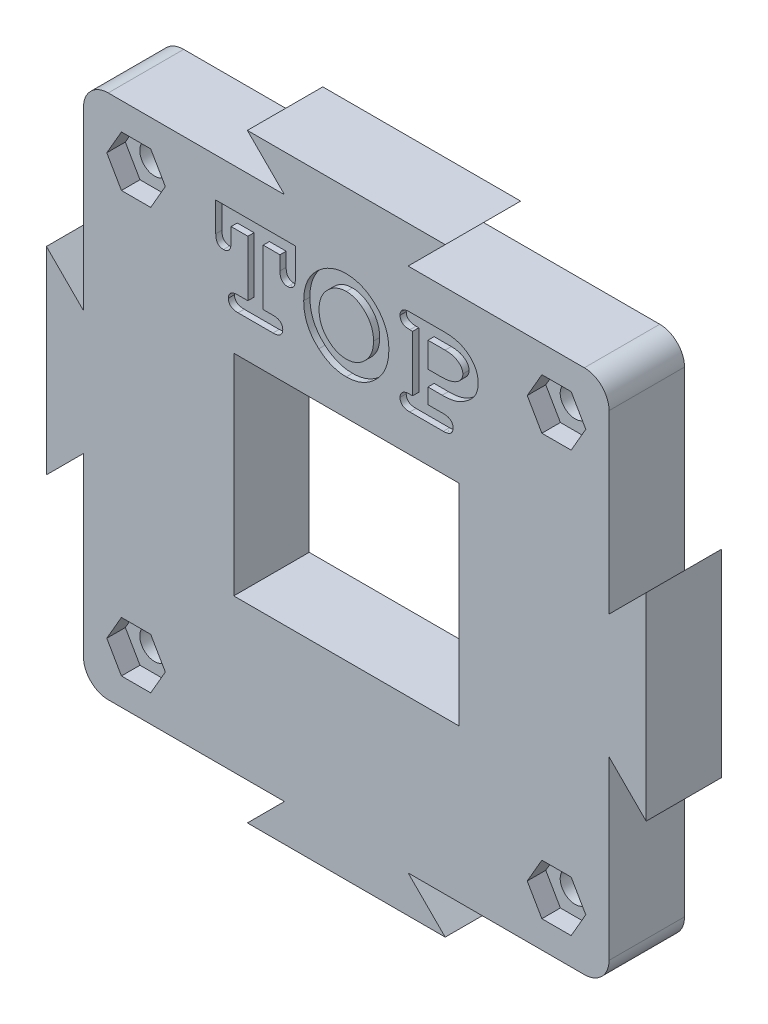
from build123d import *

# Parameters (mm, degrees)
SKETCH1_R           = 1.2
SKETCH1_W           = 18.2
SKETCH1_H           = 17
BOSS_EXTRUDE1_DEPTH = 6.1
CUT_EXTRUDE3_DEPTH  = 1
CUT_EXTRUDE4_DEPTH  = 1.5
CUT_EXTRUDE5_DEPTH  = 0.5


with BuildPart() as part:
    # Sketch1 → Boss-Extrude1 (new body)
    with BuildSketch(Plane.XY):
        with BuildLine():
            Line((-5, 21.25), (-19.25, 21.25))
            ThreePointArc((-19.25, 21.25), (-20.664213562, 20.664213562), (-21.25, 19.25))
            Line((-21.25, 19.25), (-21.25, 5))
            Line((-21.25, 5), (-24.25, 8))
            Line((-24.25, 8), (-24.25, -8))
            Line((-24.25, -8), (-21.25, -5))
            Line((-21.25, -5), (-21.25, -19.25))
            ThreePointArc((-21.25, -19.25), (-20.664213562, -20.664213562), (-19.25, -21.25))
            Line((-19.25, -21.25), (-5, -21.25))
            Line((-5, -21.25), (-8, -24.25))
            Line((-8, -24.25), (8, -24.25))
            Line((8, -24.25), (5, -21.25))
            Line((5, -21.25), (19.25, -21.25))
            ThreePointArc((19.25, -21.25), (20.664213562, -20.664213562), (21.25, -19.25))
            Line((21.25, -19.25), (21.25, -5))
            Line((21.25, -5), (24.25, -8))
            Line((24.25, -8), (24.25, 8))
            Line((24.25, 8), (21.25, 5))
            Line((21.25, 5), (21.25, 19.25))
            ThreePointArc((21.25, 19.25), (20.664213562, 20.664213562), (19.25, 21.25))
            Line((19.25, 21.25), (5, 21.25))
            Line((5, 21.25), (8, 24.25))
            Line((8, 24.25), (-8, 24.25))
            Line((-8, 24.25), (-5, 21.25))
        make_face()
        with Locations((-17, -17)):
            Circle(SKETCH1_R, mode=Mode.SUBTRACT)
        with Locations((17, -17)):
            Circle(SKETCH1_R, mode=Mode.SUBTRACT)
        with Locations((17, 17)):
            Circle(SKETCH1_R, mode=Mode.SUBTRACT)
        with Locations((-17, 17)):
            Circle(SKETCH1_R, mode=Mode.SUBTRACT)
        with Locations((0, -0.4)):
            Rectangle(SKETCH1_W, SKETCH1_H, mode=Mode.SUBTRACT)
    extrude(amount=BOSS_EXTRUDE1_DEPTH)

    # Sketch2 → Cut-Extrude3 (cut)
    with BuildSketch(Plane(origin=(0, 0, 0), x_dir=(-1, 0, 0), z_dir=(0, 0, -1))):
        with BuildLine():
            Line((-9.5, 18.25), (9.5, 18.25))
            ThreePointArc((9.5, 18.25), (10.75, 17), (9.5, 15.75))
            Line((9.5, 15.75), (-9.5, 15.75))
            ThreePointArc((-9.5, 15.75), (-10.75, 17), (-9.5, 18.25))
        make_face()
    extrude(amount=-CUT_EXTRUDE3_DEPTH, mode=Mode.SUBTRACT)

    # Sketch3 → Cut-Extrude4 (cut)
    with BuildSketch(Plane.XY.offset(6.1)):
        Polygon((-18.183568052, -14.95), (-19.367136104, -17), (-18.183568052, -19.05), (-15.816431948, -19.05), (-14.632863896, -17), (-15.816431948, -14.95), align=None)
        Polygon((15.816431948, -14.95), (14.632863896, -17), (15.816431948, -19.05), (18.183568052, -19.05), (19.367136104, -17), (18.183568052, -14.95), align=None)
        Polygon((-18.183568052, 19.05), (-19.367136104, 17), (-18.183568052, 14.95), (-15.816431948, 14.95), (-14.632863896, 17), (-15.816431948, 19.05), align=None)
        Polygon((15.816431948, 19.05), (14.632863896, 17), (15.816431948, 14.95), (18.183568052, 14.95), (19.367136104, 17), (18.183568052, 19.05), align=None)
    extrude(amount=-CUT_EXTRUDE4_DEPTH, mode=Mode.SUBTRACT)

    # Sketch4 → Cut-Extrude5 (cut)
    # profile 1 of 3: a face of its own
    with BuildSketch(Plane.XY.offset(6.1)):
        with BuildLine():
            Line((-6.717741935, 16.858064516), (-6.717741935, 12.341935484))
            Line((-6.717741935, 12.341935484), (-5.927419355, 12.341935484))
            add(Edge.make_bspline(
                [(-5.927419355, 12.341935484), (-5.863148246, 12.340349698), (-5.742415246, 12.337370807), (-5.575414873, 12.304299508), (-5.435165873, 12.250599117), (-5.324117222, 12.172513537), (-5.240499467, 12.077832245), (-5.180080261, 11.970275939), (-5.143989419, 11.8496603), (-5.139440666, 11.764730535), (-5.137096774, 11.720967742)],
                knots=[0, 0, 0, 0, 1.353154287, 2.541894464, 3.570795155, 4.495901044, 5.373971119, 6.211928534, 7.078638652, 8, 8, 8, 8], degree=3))
            add(Edge.make_bspline(
                [(-5.137096774, 11.720967742), (-5.139411719, 11.67718849), (-5.143904296, 11.592226784), (-5.18054359, 11.471340401), (-5.239890455, 11.36255897), (-5.32423841, 11.267819013), (-5.434764703, 11.189183916), (-5.575891283, 11.138241303), (-5.742334201, 11.104365055), (-5.86312009, 11.101516436), (-5.927419355, 11.1)],
                knots=[0, 0, 0, 0, 0.920639213, 1.786670031, 2.634802021, 3.512183892, 4.436564712, 5.460097794, 6.647906274, 8, 8, 8, 8], degree=3))
            Line((-5.927419355, 11.1), (-8.75, 11.1))
            add(Edge.make_bspline(
                [(-8.75, 11.1), (-8.814285929, 11.101533344), (-8.935046767, 11.104413724), (-9.101652606, 11.138083415), (-9.242728791, 11.189834025), (-9.354888209, 11.266612833), (-9.437344663, 11.363255186), (-9.496975861, 11.471245143), (-9.533487954, 11.592252578), (-9.537998419, 11.677197261), (-9.540322581, 11.720967742)],
                knots=[0, 0, 0, 0, 1.351758791, 2.539273031, 3.562552567, 4.496852515, 5.365850662, 6.213772556, 7.079588844, 8, 8, 8, 8], degree=3))
            add(Edge.make_bspline(
                [(-9.540322581, 11.720967742), (-9.537969451, 11.764721754), (-9.533402769, 11.849634476), (-9.497438896, 11.970370805), (-9.436744196, 12.07714303), (-9.355010217, 12.173719777), (-9.242323038, 12.249940289), (-9.102128968, 12.304456905), (-8.934965801, 12.337322371), (-8.814257801, 12.340332871), (-8.75, 12.341935484)],
                knots=[0, 0, 0, 0, 0.921132933, 1.787628184, 2.62537786, 3.495057466, 4.430090083, 5.458735699, 6.647181174, 8, 8, 8, 8], degree=3))
            Line((-8.75, 12.341935484), (-7.959677419, 12.341935484))
            Line((-7.959677419, 12.341935484), (-7.959677419, 16.858064516))
            Line((-7.959677419, 16.858064516), (-9.314516129, 16.858064516))
            Line((-9.314516129, 16.858064516), (-9.314516129, 15.729032258))
            add(Edge.make_bspline(
                [(-9.314516129, 15.729032258), (-9.316118741, 15.664774457), (-9.319129242, 15.544066457), (-9.351994707, 15.37690329), (-9.406511324, 15.23670922), (-9.482731835, 15.124022041), (-9.579308583, 15.042288062), (-9.686080808, 14.981593362), (-9.806817137, 14.945629489), (-9.891729859, 14.941062807), (-9.935483871, 14.938709677)],
                knots=[0, 0, 0, 0, 1.352818826, 2.541264301, 3.569909917, 4.504942534, 5.37462214, 6.212371816, 7.078867067, 8, 8, 8, 8], degree=3))
            add(Edge.make_bspline(
                [(-9.935483871, 14.938709677), (-9.979254352, 14.941033839), (-10.064199035, 14.945544304), (-10.18520647, 14.982056397), (-10.293196427, 15.041687595), (-10.38983878, 15.124144049), (-10.466617587, 15.236303467), (-10.518368198, 15.377379652), (-10.552037889, 15.543985491), (-10.554918269, 15.664746329), (-10.556451613, 15.729032258)],
                knots=[0, 0, 0, 0, 0.920411156, 1.786227444, 2.634149338, 3.503147485, 4.437447433, 5.460726969, 6.648241209, 8, 8, 8, 8], degree=3))
            Line((-10.556451613, 15.729032258), (-10.556451613, 18.1))
            Line((-10.556451613, 18.1), (-4.120967742, 18.1))
            Line((-4.120967742, 18.1), (-4.120967742, 15.729032258))
            add(Edge.make_bspline(
                [(-4.120967742, 15.729032258), (-4.122570354, 15.664774457), (-4.125580855, 15.544066457), (-4.15844632, 15.37690329), (-4.212962937, 15.23670922), (-4.289183448, 15.124022041), (-4.385760196, 15.042288062), (-4.492532421, 14.981593362), (-4.61326875, 14.945629489), (-4.698181472, 14.941062807), (-4.741935484, 14.938709677)],
                knots=[0, 0, 0, 0, 1.352818826, 2.541264301, 3.569909917, 4.504942534, 5.37462214, 6.212371816, 7.078867067, 8, 8, 8, 8], degree=3))
            add(Edge.make_bspline(
                [(-4.741935484, 14.938709677), (-4.785705965, 14.941033839), (-4.870650647, 14.945544304), (-4.991658082, 14.982056397), (-5.09964804, 15.041687595), (-5.196290393, 15.124144049), (-5.2730692, 15.236303467), (-5.324819811, 15.377379652), (-5.358489502, 15.543985491), (-5.361369882, 15.664746329), (-5.362903226, 15.729032258)],
                knots=[0, 0, 0, 0, 0.920411156, 1.786227444, 2.634149338, 3.503147485, 4.437447433, 5.460726969, 6.648241209, 8, 8, 8, 8], degree=3))
            Line((-5.362903226, 15.729032258), (-5.362903226, 16.858064516))
            Line((-5.362903226, 16.858064516), (-6.717741935, 16.858064516))
        make_face()
    # profile 2 of 3: a face of its own
    with BuildSketch(Plane.XY.offset(6.1)):
        with BuildLine():
            add(Edge.make_bspline(
                [(3.443548387, 14.596471774), (3.440768135, 14.469872192), (3.43530187, 14.220964285), (3.384240039, 13.856547556), (3.303430808, 13.508493952), (3.18990528, 13.176073594), (3.043492439, 12.85927086), (2.86230178, 12.559885998), (2.648367688, 12.277756214), (2.407032439, 12.014221053), (2.145091658, 11.774181148), (1.867939271, 11.56507818), (1.582463144, 11.385621278), (1.285073961, 11.239704237), (0.977784758, 11.125989141), (0.659276661, 11.047638273), (0.331615265, 10.995330959), (0.108991475, 10.989861286), (-0.003528226, 10.987096774)],
                knots=[0, 0, 0, 0, 1.094929274, 2.152744503, 3.177137145, 4.182820699, 5.186765039, 6.191160575, 7.204742221, 8.245594793, 9.279258829, 10.274526544, 11.245900401, 12.192545204, 13.135888647, 14.0750236, 15.027068184, 16, 16, 16, 16], degree=3))
            add(Edge.make_bspline(
                [(-0.003528226, 10.987096774), (-0.104783693, 10.990084079), (-0.305676528, 10.996010949), (-0.603005186, 11.03505148), (-0.892607204, 11.102249519), (-1.173562194, 11.198894748), (-1.448464178, 11.318909387), (-1.715948566, 11.466394913), (-1.976145498, 11.640710578), (-2.138659708, 11.775929717), (-2.221018145, 11.844455645)],
                knots=[0, 0, 0, 0, 0.999768647, 1.983560634, 2.955371214, 3.93036818, 4.913148714, 5.913625258, 6.942673607, 8, 8, 8, 8], degree=3))
            add(Edge.make_bspline(
                [(-2.221018145, 11.844455645), (-2.318278926, 11.934209759), (-2.510060195, 12.111189194), (-2.76018462, 12.40823581), (-2.970468425, 12.725657212), (-3.14586036, 13.061370626), (-3.279622713, 13.417629903), (-3.375322538, 13.7931879), (-3.432447151, 14.188380579), (-3.439800111, 14.458681857), (-3.443548387, 14.596471774)],
                knots=[0, 0, 0, 0, 1.020221724, 2.011699023, 2.986768456, 3.952539234, 4.927344826, 5.915360336, 6.937325315, 8, 8, 8, 8], degree=3))
            add(Edge.make_bspline(
                [(-3.443548387, 14.596471774), (-3.439810363, 14.734263637), (-3.432477513, 15.004568732), (-3.375126177, 15.400299201), (-3.279590039, 15.77702639), (-3.146253418, 16.134660388), (-2.970493748, 16.470851099), (-2.759691164, 16.788413268), (-2.510179081, 17.087053018), (-2.318305897, 17.265210858), (-2.221018145, 17.355544355)],
                knots=[0, 0, 0, 0, 1.060651223, 2.080670257, 3.07119143, 4.048377256, 5.012309089, 5.985521871, 6.978575096, 8, 8, 8, 8], degree=3))
            add(Edge.make_bspline(
                [(-2.221018145, 17.355544355), (-2.138652407, 17.424052836), (-1.976123791, 17.559237549), (-1.716031724, 17.733803804), (-1.447955263, 17.880487434), (-1.174391458, 18.003835084), (-0.892169815, 18.097081357), (-0.603073886, 18.165140676), (-0.305658938, 18.203939851), (-0.104777798, 18.209899434), (-0.003528226, 18.212903226)],
                knots=[0, 0, 0, 0, 1.057260928, 2.086245564, 3.086660163, 4.071726737, 5.044811768, 6.016562178, 7.000293253, 8, 8, 8, 8], degree=3))
            add(Edge.make_bspline(
                [(-0.003528226, 18.212903226), (0.108947589, 18.20988414), (0.33139806, 18.203913104), (0.659756114, 18.155311465), (0.977443937, 18.073247517), (1.285215005, 17.960647935), (1.581820697, 17.813915337), (1.869085842, 17.637198447), (2.144430785, 17.42549649), (2.407069631, 17.185877832), (2.648943637, 16.922077374), (2.861818978, 16.638557206), (3.043036954, 16.33936374), (3.190668556, 16.023066596), (3.303633044, 15.689151082), (3.383833481, 15.339249928), (3.435449701, 14.973172224), (3.440813858, 14.72366502), (3.443548387, 14.596471774)],
                knots=[0, 0, 0, 0, 0.971707335, 1.92180653, 2.861011471, 3.803167671, 4.748621076, 5.716093444, 6.713182507, 7.745545627, 8.785088237, 9.801455117, 10.804586573, 11.802659367, 12.811886603, 13.844887421, 14.901371338, 16, 16, 16, 16], degree=3))
        make_face()
        with BuildLine():
            add(Edge.make_bspline(
                [(2.201612903, 14.596471774), (2.199666334, 14.680661835), (2.195853979, 14.845548015), (2.163364121, 15.087203142), (2.109971676, 15.317242791), (2.038769395, 15.537483124), (1.942146655, 15.745183641), (1.824776556, 15.941277134), (1.689229224, 16.128652797), (1.529723468, 16.29851233), (1.3618191, 16.456376066), (1.183521334, 16.593386926), (1.000438128, 16.709495602), (0.8119488, 16.807538593), (0.615505415, 16.87814163), (0.41458012, 16.932479146), (0.20745506, 16.964914384), (0.067147255, 16.968939979), (-0.003528226, 16.970967742)],
                knots=[0, 0, 0, 0, 1.122536616, 2.19848724, 3.244874716, 4.269190481, 5.279843255, 6.292684775, 7.313903152, 8.357465095, 9.395263989, 10.385130857, 11.35119052, 12.28421157, 13.212274806, 14.129235888, 15.057663596, 16, 16, 16, 16], degree=3))
            add(Edge.make_bspline(
                [(-0.003528226, 16.970967742), (-0.073625475, 16.96896849), (-0.212782839, 16.964999567), (-0.41858796, 16.93205665), (-0.618971139, 16.878991632), (-0.813823522, 16.804980592), (-1.001639853, 16.707546507), (-1.186471569, 16.593855277), (-1.362691529, 16.454119626), (-1.53245874, 16.297593674), (-1.688175193, 16.123852922), (-1.8272648, 15.939048714), (-1.941639749, 15.740980762), (-2.038971731, 15.534071422), (-2.109625178, 15.314202579), (-2.163617022, 15.084915627), (-2.195726942, 14.844355676), (-2.199627915, 14.680068421), (-2.201612903, 14.596471774)],
                knots=[0, 0, 0, 0, 0.936482685, 1.859109494, 2.778012839, 3.703447446, 4.638444776, 5.602362168, 6.599140281, 7.639137391, 8.685441249, 9.713490152, 10.724482739, 11.737276228, 12.763761649, 13.804708691, 14.882938341, 16, 16, 16, 16], degree=3))
            add(Edge.make_bspline(
                [(-2.201612903, 14.596471774), (-2.199681627, 14.512865934), (-2.19589968, 14.349143738), (-2.163126113, 14.108717822), (-2.110274658, 13.879735724), (-2.038550944, 13.660175206), (-1.941603874, 13.453779809), (-1.82782704, 13.255810648), (-1.687470142, 13.07259025), (-1.533142356, 12.898748684), (-1.362051131, 12.74422346), (-1.186570733, 12.604248144), (-1.001557989, 12.490872828), (-0.814232255, 12.392766221), (-0.618559604, 12.32151054), (-0.418644254, 12.267794908), (-0.212768495, 12.235038258), (-0.07362067, 12.23104418), (-0.003528226, 12.229032258)],
                knots=[0, 0, 0, 0, 1.118599469, 2.190511572, 3.240559024, 4.260987997, 5.275175755, 6.287560131, 7.310717123, 8.358461383, 9.394553109, 10.392703443, 11.357947819, 12.294232319, 13.218162791, 14.138331151, 15.0622281, 16, 16, 16, 16], degree=3))
            add(Edge.make_bspline(
                [(-0.003528226, 12.229032258), (0.067167036, 12.230992547), (0.207514111, 12.234884192), (0.414202183, 12.268284874), (0.616277134, 12.318900189), (0.811008435, 12.393513546), (1.000989117, 12.488154269), (1.183499692, 12.604976067), (1.361237107, 12.741877316), (1.530296527, 12.897920737), (1.689239997, 13.067855358), (1.824153781, 13.254957013), (1.943201134, 13.450151101), (2.037852493, 13.658195765), (2.110406731, 13.877892359), (2.163278761, 14.107537031), (2.195796065, 14.348567246), (2.199651226, 14.512868171), (2.201612903, 14.596471774)],
                knots=[0, 0, 0, 0, 0.943691391, 1.873454087, 2.789749725, 3.721897961, 4.652721651, 5.620170414, 6.611460613, 7.645425613, 8.690488095, 9.713174884, 10.720729729, 11.739972406, 12.758306802, 13.806198881, 14.883696616, 16, 16, 16, 16], degree=3))
        make_face(mode=Mode.SUBTRACT)
    # profile 3 of 3: a face of its own
    with BuildSketch(Plane.XY.offset(6.1)):
        with BuildLine():
            Line((6.60483871, 13.583870968), (6.60483871, 12.341935484))
            Line((6.60483871, 12.341935484), (7.846774194, 12.341935484))
            add(Edge.make_bspline(
                [(7.846774194, 12.341935484), (7.911045303, 12.340349698), (8.031778303, 12.337370807), (8.198778676, 12.304299508), (8.339027676, 12.250599117), (8.450076326, 12.172513537), (8.533694082, 12.077832245), (8.594113287, 11.970275939), (8.63020413, 11.8496603), (8.634752883, 11.764730535), (8.637096774, 11.720967742)],
                knots=[0, 0, 0, 0, 1.353154287, 2.541894464, 3.570795155, 4.495901044, 5.373971119, 6.211928534, 7.078638652, 8, 8, 8, 8], degree=3))
            add(Edge.make_bspline(
                [(8.637096774, 11.720967742), (8.634781829, 11.67718849), (8.630289253, 11.592226784), (8.593649958, 11.471340401), (8.534303093, 11.36255897), (8.449955138, 11.267819013), (8.339428846, 11.189183916), (8.198302265, 11.138241303), (8.031859348, 11.104365055), (7.911073458, 11.101516436), (7.846774194, 11.1)],
                knots=[0, 0, 0, 0, 0.920639213, 1.786670031, 2.634802021, 3.512183892, 4.436564712, 5.460097794, 6.647906274, 8, 8, 8, 8], degree=3))
            Line((7.846774194, 11.1), (5.137096774, 11.1))
            add(Edge.make_bspline(
                [(5.137096774, 11.1), (5.072810846, 11.101533344), (4.952050007, 11.104413724), (4.785444169, 11.138083415), (4.644367984, 11.189834025), (4.532208565, 11.266612833), (4.449752111, 11.363255186), (4.390120913, 11.471245143), (4.35360882, 11.592252578), (4.349098356, 11.677197261), (4.346774194, 11.720967742)],
                knots=[0, 0, 0, 0, 1.351758791, 2.539273031, 3.562552567, 4.496852515, 5.365850662, 6.213772556, 7.079588844, 8, 8, 8, 8], degree=3))
            add(Edge.make_bspline(
                [(4.346774194, 11.720967742), (4.349127323, 11.764721754), (4.353694006, 11.849634476), (4.389657878, 11.970370805), (4.450352578, 12.07714303), (4.532086557, 12.173719777), (4.644773736, 12.249940289), (4.784967806, 12.304456905), (4.952130973, 12.337322371), (5.072838974, 12.340332871), (5.137096774, 12.341935484)],
                knots=[0, 0, 0, 0, 0.921132933, 1.787628184, 2.62537786, 3.495057466, 4.430090083, 5.458735699, 6.647181174, 8, 8, 8, 8], degree=3))
            Line((5.137096774, 12.341935484), (5.362903226, 12.341935484))
            Line((5.362903226, 12.341935484), (5.362903226, 16.858064516))
            Line((5.362903226, 16.858064516), (5.137096774, 16.858064516))
            add(Edge.make_bspline(
                [(5.137096774, 16.858064516), (5.072810846, 16.85959786), (4.952050007, 16.86247824), (4.785444169, 16.896147931), (4.644367984, 16.947898542), (4.532208565, 17.024677349), (4.449752111, 17.121319702), (4.390120913, 17.229309659), (4.35360882, 17.350317095), (4.349098356, 17.435261777), (4.346774194, 17.479032258)],
                knots=[0, 0, 0, 0, 1.351758791, 2.539273031, 3.562552567, 4.496852515, 5.365850662, 6.213772556, 7.079588844, 8, 8, 8, 8], degree=3))
            add(Edge.make_bspline(
                [(4.346774194, 17.479032258), (4.349127323, 17.52278627), (4.353694006, 17.607698992), (4.389657878, 17.728435321), (4.450352578, 17.835207546), (4.532086557, 17.931784294), (4.644773736, 18.008004805), (4.784967806, 18.062521422), (4.952130973, 18.095386887), (5.072838974, 18.098397388), (5.137096774, 18.1)],
                knots=[0, 0, 0, 0, 0.921132933, 1.787628184, 2.62537786, 3.495057466, 4.430090083, 5.458735699, 6.647181174, 8, 8, 8, 8], degree=3))
            Line((5.137096774, 18.1), (7.966733871, 18.1))
            add(Edge.make_bspline(
                [(7.966733871, 18.1), (8.067953689, 18.097939062), (8.265558597, 18.093915626), (8.553348042, 18.063486693), (8.825526389, 18.014592556), (9.081590886, 17.944737505), (9.321134986, 17.852247357), (9.544562522, 17.740837503), (9.752789085, 17.609987831), (9.941933401, 17.458271414), (10.112522998, 17.293345217), (10.261826377, 17.118104621), (10.388058449, 16.933736301), (10.491144755, 16.740326141), (10.570951709, 16.538431602), (10.62719148, 16.327687697), (10.664448171, 16.108464836), (10.667704214, 15.958522281), (10.669354839, 15.882510081)],
                knots=[0, 0, 0, 0, 1.241595907, 2.423887441, 3.545990142, 4.631120813, 5.674787891, 6.691067699, 7.689784042, 8.685760776, 9.660211043, 10.596862231, 11.505306434, 12.396047468, 13.280220304, 14.162242044, 15.06836304, 16, 16, 16, 16], degree=3))
            add(Edge.make_bspline(
                [(10.669354839, 15.882510081), (10.666061398, 15.798231063), (10.659521696, 15.630880383), (10.614306465, 15.38355212), (10.53884761, 15.143119506), (10.464937374, 14.991981125), (10.427671371, 14.91577621)],
                knots=[0, 0, 0, 0, 1.00499573, 1.995594191, 2.989366067, 4, 4, 4, 4], degree=3))
            add(Edge.make_bspline(
                [(10.427671371, 14.91577621), (10.393137273, 14.858404911), (10.321047374, 14.738642373), (10.180813719, 14.569939261), (10.011556879, 14.401537113), (9.816098133, 14.238431381), (9.604881628, 14.085982489), (9.386694572, 13.951040187), (9.166771546, 13.835872473), (8.93855464, 13.740458358), (8.689601301, 13.66864615), (8.41006874, 13.618845072), (8.094956053, 13.589655574), (7.873301335, 13.585863827), (7.756804435, 13.583870968)],
                knots=[0, 0, 0, 0, 0.770305632, 1.608012352, 2.517893962, 3.517697702, 4.536451801, 5.515651723, 6.46982344, 7.392966776, 8.359531939, 9.447455083, 10.658437892, 12, 12, 12, 12], degree=3))
            Line((7.756804435, 13.583870968), (6.60483871, 13.583870968))
        make_face()
        with BuildLine():
            Line((6.60483871, 14.825806452), (7.719758065, 14.825806452))
            add(Edge.make_bspline(
                [(7.719758065, 14.825806452), (7.783878861, 14.826913555), (7.908164092, 14.829059453), (8.089672999, 14.843039323), (8.261233706, 14.867490473), (8.422695443, 14.902590045), (8.574460523, 14.946726051), (8.715820098, 15.0010249), (8.846599871, 15.066634286), (8.966454634, 15.140430139), (9.074106969, 15.221193311), (9.167887623, 15.30773261), (9.24777576, 15.398063306), (9.314899145, 15.491758096), (9.363480848, 15.592049444), (9.401932764, 15.694361953), (9.423305585, 15.801656362), (9.426041143, 15.874191612), (9.427419355, 15.910735887)],
                knots=[0, 0, 0, 0, 1.374388072, 2.663974064, 3.89925897, 5.085938153, 6.202681255, 7.284082484, 8.326892458, 9.334290039, 10.297261235, 11.207043176, 12.064320358, 12.879029646, 13.66818314, 14.445674875, 15.216909235, 16, 16, 16, 16], degree=3))
            add(Edge.make_bspline(
                [(9.427419355, 15.910735887), (9.423161471, 15.972582932), (9.41460347, 16.09689048), (9.338723376, 16.274242323), (9.217310902, 16.436005915), (9.083947734, 16.556590379), (8.957102503, 16.643626962), (8.847463822, 16.699962212), (8.72960573, 16.749189563), (8.60126466, 16.790881375), (8.461927713, 16.818768027), (8.313244993, 16.843189357), (8.154474367, 16.854127104), (8.045538746, 16.85672969), (7.989667339, 16.858064516)],
                knots=[0, 0, 0, 0, 1.161610864, 2.334743684, 3.571687388, 4.952410177, 5.702465631, 6.465912368, 7.270715245, 8.108423406, 9.004029882, 9.946092044, 10.946582139, 12, 12, 12, 12], degree=3))
            Line((7.989667339, 16.858064516), (6.60483871, 16.858064516))
            Line((6.60483871, 16.858064516), (6.60483871, 14.825806452))
        make_face(mode=Mode.SUBTRACT)
    extrude(amount=-CUT_EXTRUDE5_DEPTH, mode=Mode.SUBTRACT)


solid = part.part
